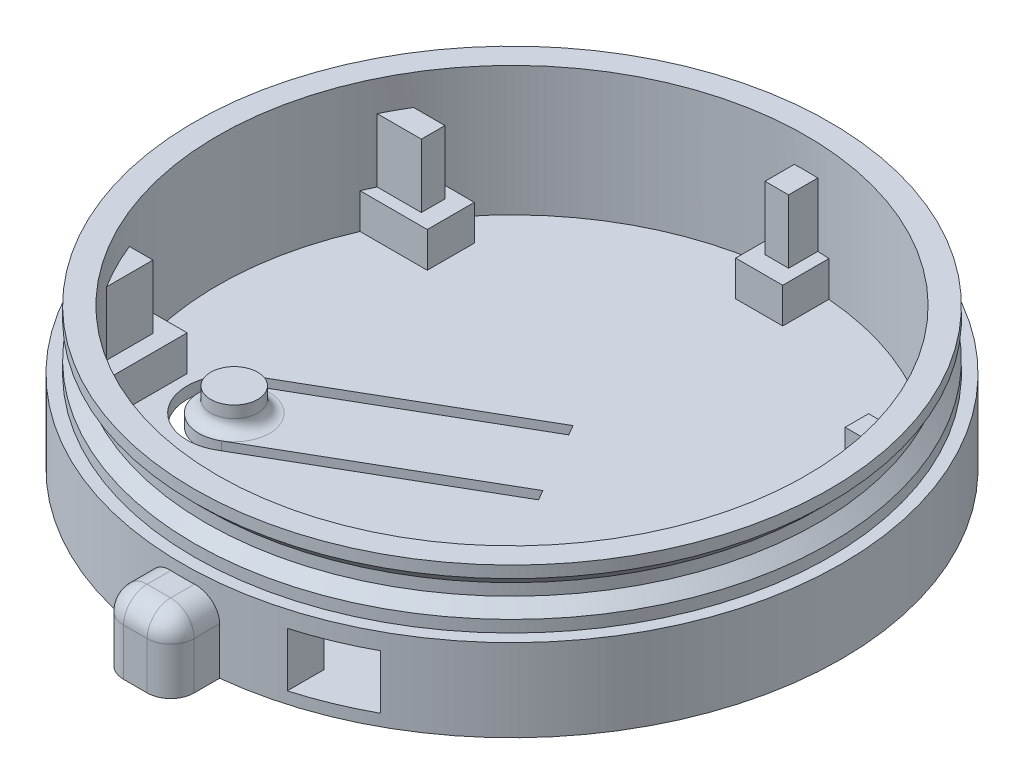
from build123d import *

# Parameters (mm, degrees)
SKETCH1_R              = 13.5
SKETCH1_R_2            = 12.5
BOSS_EXTRUDE1_DEPTH    = 6
SKETCH1_2_R            = 12.5
BOSS_EXTRUDE3_DEPTH    = 0.5
SKETCH1_3_R            = 14
SKETCH1_3_R_2          = 13.5
SKETCH1_3_R_3          = 13
SKETCH1_3_R_4          = 12.5
EXTRUDE_THIN1_DEPTH    = 3.5
SKETCH12_W             = 2.5
SKETCH12_H             = 2.5
SKETCH12_R             = 0.5
BOSS_EXTRUDE10_DEPTH   = 1.5
BOSS_EXTRUDE12_DEPTH   = 2.7
CUT_EXTRUDE1_DEPTH     = 10
SKETCH14_R             = 1
BOSS_EXTRUDE11_DEPTH   = 1
FILLET7_R              = 0.5
CUT_EXTRUDE2_DEPTH     = 2.3
BOSS_EXTRUDE13_DEPTH   = 3
BOSS_EXTRUDE13_2_DEPTH = 3
FILLET8_R              = 1
FILLET9_R              = 1
CUT_EXTRUDE3_START     = 1
SKETCH18_R             = 13.5
SKETCH18_R_2           = 13
CUT_EXTRUDE3_DEPTH     = 0.5
CHAMFER1_SIZE          = 0.5
CHAMFER3_SIZE          = 0.5


with BuildPart() as part:
    # Sketch1 → Boss-Extrude1 (new body)
    with BuildSketch(Plane(origin=(0, 0, 0), x_dir=(1, 0, 0), z_dir=(0, 1, 0))):
        with Locations(Location((0, 0, 0), (0, 0, 270))):
            Circle(SKETCH1_R)
        with Locations(Location((0, 0, 0), (0, 0, 270))):
            Circle(SKETCH1_R_2, mode=Mode.SUBTRACT)
    extrude(amount=BOSS_EXTRUDE1_DEPTH)

    # Sketch1<2> → Boss-Extrude3 (add)
    with BuildSketch(Plane(origin=(0, 0, 0), x_dir=(1, 0, 0), z_dir=(0, 1, 0))):
        with Locations(Location((0, 0, 0), (0, 0, 270))):
            Circle(SKETCH1_2_R)
    extrude(amount=BOSS_EXTRUDE3_DEPTH)

    # Sketch1<3> → Extrude-Thin1 (add)
    # profile 1 of 2: a face of its own
    with BuildSketch(Plane(origin=(0, 0, 0), x_dir=(1, 0, 0), z_dir=(0, 1, 0))):
        Circle(SKETCH1_3_R)
        Circle(SKETCH1_3_R_2, mode=Mode.SUBTRACT)
    # profile 2 of 2: a face of its own
    with BuildSketch(Plane(origin=(0, 0, 0), x_dir=(1, 0, 0), z_dir=(0, 1, 0))):
        Circle(SKETCH1_3_R_3)
        Circle(SKETCH1_3_R_4, mode=Mode.SUBTRACT)
    extrude(amount=EXTRUDE_THIN1_DEPTH)

    # Sketch12 → Boss-Extrude10 (add)
    # profile 1 of 5: a face of its own
    with BuildSketch(Plane(origin=(0, 0.5, 0), x_dir=(1, 0, 0), z_dir=(0, 1, 0))):
        with BuildLine():
            Line((-8.6, 5), (-8.6, 7))
            Line((-8.6, 7), (-10.356157589, 7))
            ThreePointArc((-10.356157589, 7), (-10.952047529, 6.025168456), (-11.456439237, 5))
            Line((-11.456439237, 5), (-8.6, 5))
        make_face()
    # profile 2 of 5: a face of its own
    with BuildSketch(Plane(origin=(0, 0.5, 0), x_dir=(1, 0, 0), z_dir=(0, 1, 0))):
        with BuildLine():
            Line((-1, 10.5), (1, 10.5))
            Line((1, 10.5), (1, 12.459935794))
            ThreePointArc((1, 12.459935794), (0, 12.5), (-1, 12.459935794))
            Line((-1, 12.459935794), (-1, 10.5))
        make_face()
    # profile 3 of 5: a face of its own
    with BuildSketch(Plane(origin=(0, 0.5, 0), x_dir=(1, 0, 0), z_dir=(0, 1, 0))):
        with BuildLine():
            Line((11.273420067, 5.4), (9.5, 5.4))
            Line((9.5, 5.4), (9.5, 3.4))
            Line((9.5, 3.4), (12.028715642, 3.4))
            ThreePointArc((12.028715642, 3.4), (11.693903632, 4.416176837), (11.273420067, 5.4))
        make_face()
    # profile 4 of 5: a face of its own
    with BuildSketch(Plane(origin=(0, 0.5, 0), x_dir=(1, 0, 0), z_dir=(0, 1, 0))):
        with BuildLine():
            Line((-9.9, -3.9), (-11.876026271, -3.9))
            ThreePointArc((-11.876026271, -3.9), (-11.046713471, -5.849796706), (-9.9, -7.631513611))
            Line((-9.9, -7.631513611), (-9.9, -3.9))
        make_face()
    # profile 5 of 5: a face of its own
    with BuildSketch(Plane(origin=(0, 0.5, 0), x_dir=(1, 0, 0), z_dir=(0, 1, 0))):
        with Locations((9.5, -4.1)):
            Rectangle(SKETCH12_W, SKETCH12_H)
        with Locations(Location((9.5, -4.1, 0), (0, 0, 270))):
            Circle(SKETCH12_R, mode=Mode.SUBTRACT)
    extrude(amount=BOSS_EXTRUDE10_DEPTH)

    # Sketch15 → Boss-Extrude12 (add)
    with BuildSketch(Plane(origin=(0, 2, 0), x_dir=(1, 0, 0), z_dir=(0, 1, 0))):
        with BuildLine():
            Line((0.5, 11.25), (0.5, 12.489995997))
            ThreePointArc((0.5, 12.489995997), (0, 12.5), (-0.5, 12.489995997))
            Line((-0.5, 12.489995997), (-0.5, 11.25))
            Line((-0.5, 11.25), (0.5, 11.25))
        make_face()
        with BuildLine():
            Line((-9.35, 5.5), (-9.35, 6))
            Line((-9.35, 6), (-9.35, 6.5))
            Line((-9.35, 6.5), (-10.677078252, 6.5))
            ThreePointArc((-10.677078252, 6.5), (-10.96243372, 6.006250655), (-11.22497216, 5.5))
            Line((-11.22497216, 5.5), (-9.35, 5.5))
        make_face()
        with BuildLine():
            Line((-11.602909118, -4.65), (-10.602909118, -4.65))
            Line((-10.602909118, -4.65), (-10.602909118, -6.620295933))
            ThreePointArc((-10.602909118, -6.620295933), (-11.146528939, -5.657286682), (-11.602909118, -4.65))
        make_face()
        with BuildLine():
            Line((10.25, 3.9), (11.876026271, 3.9))
            ThreePointArc((11.876026271, 3.9), (11.698485768, 4.404024379), (11.499565209, 4.9))
            Line((11.499565209, 4.9), (10.25, 4.9))
            Line((10.25, 4.9), (10.25, 3.9))
        make_face()
    extrude(amount=BOSS_EXTRUDE12_DEPTH)

    # Sketch13 → Cut-Extrude1 (cut)
    with BuildSketch(Plane(origin=(0, 0.5, 0), x_dir=(1, 0, 0), z_dir=(0, 1, 0))):
        with BuildLine():
            Line((0.209608339, 2.382785463), (-8.450166114, -2.618045109))
            ThreePointArc((-8.450166114, -2.618045109), (-7.773231209, -2.376292426), (-7.054544105, -2.38948613))
            Line((-7.054544105, -2.38948613), (0.459649868, 1.94979674))
            Line((0.459649868, 1.94979674), (0.209608339, 2.382785463))
        make_face()
        with BuildLine():
            ThreePointArc((-7.054544105, -2.38948613), (-7.773231209, -2.376292426), (-8.450166114, -2.618045109))
            Line((-8.450166114, -2.618045109), (-8.200124586, -3.051033832))
            Line((-8.200124586, -3.051033832), (-7.054544105, -2.38948613))
        make_face()
        with BuildLine():
            ThreePointArc((-8.450166114, -2.618045109), (-9.181954891, -5.350166114), (-6.449833886, -6.081954891))
            Line((-6.449833886, -6.081954891), (-6.699875414, -5.648966168))
            ThreePointArc((-6.699875414, -5.648966168), (-8.748966168, -5.100124586), (-8.200124586, -3.051033832))
            Line((-8.200124586, -3.051033832), (-8.450166114, -2.618045109))
        make_face()
        with BuildLine():
            Line((-6.699875414, -5.648966168), (-6.449833886, -6.081954891))
            ThreePointArc((-6.449833886, -6.081954891), (-5.902091744, -5.616483332), (-5.554294933, -4.987418466))
            Line((-5.554294933, -4.987418466), (-6.699875414, -5.648966168))
        make_face()
        with BuildLine():
            ThreePointArc((-5.554294933, -4.987418466), (-5.902091744, -5.616483332), (-6.449833886, -6.081954891))
            Line((-6.449833886, -6.081954891), (2.209940568, -1.081124319))
            Line((2.209940568, -1.081124319), (1.95989904, -0.648135596))
            Line((1.95989904, -0.648135596), (-5.554294933, -4.987418466))
        make_face()
    extrude(amount=-CUT_EXTRUDE1_DEPTH, mode=Mode.SUBTRACT)

    # Sketch14 → Boss-Extrude11 (add)
    with BuildSketch(Plane(origin=(0, 0.5, 0), x_dir=(1, 0, 0), z_dir=(0, 1, 0))):
        with Locations(Location((-7.45, -4.35, 0), (0, 0, 270))):
            Circle(SKETCH14_R)
    extrude(amount=BOSS_EXTRUDE11_DEPTH)

    # Fillet7
    fillet7_edges = [part.edges().sort_by_distance(p)[0] for p in [
        (-7.45, 0.5, 3.35),
    ]]
    fillet(fillet7_edges, radius=FILLET7_R - 0.0001)  # a hair under: the kernel refuses the full size

    # Sketch16 → Cut-Extrude2 (cut)
    with BuildSketch(Plane(origin=(0, 0.5, 0), x_dir=(1, 0, 0), z_dir=(0, 1, 0))):
        with BuildLine():
            Line((3.9, -10.1), (3.9, -13.445817193))
            ThreePointArc((3.9, -13.445817193), (5.331269165, -12.945175514), (6.7, -12.292680749))
            Line((6.7, -12.292680749), (6.7, -9.45))
            Line((6.7, -9.45), (3.9, -10.1))
        make_face()
    extrude(amount=CUT_EXTRUDE2_DEPTH, mode=Mode.SUBTRACT)

    # Sketch18 → Cut-Extrude3 (cut)
    with BuildSketch(Plane(origin=(0, 3.5, 0), x_dir=(1, 0, 0), z_dir=(0, 1, 0)).offset(CUT_EXTRUDE3_START)):
        with Locations(Location((0, 0, 0), (0, 0, 270))):
            Circle(SKETCH18_R)
        with Locations(Location((0, 0, 0), (0, 0, 270))):
            Circle(SKETCH18_R_2, mode=Mode.SUBTRACT)
    extrude(amount=CUT_EXTRUDE3_DEPTH, mode=Mode.SUBTRACT)

    # Chamfer1
    chamfer1_edges = [part.edges().sort_by_distance(p)[0] for p in [
        (0, 5, -13.5),
    ]]
    chamfer(chamfer1_edges, length=CHAMFER1_SIZE - 0.0001)  # a hair under: the kernel refuses the full size

    # Chamfer3
    chamfer3_edges = [part.edges().sort_by_distance(p)[0] for p in [
        (0, 4.5, -13.5),
    ]]
    chamfer(chamfer3_edges, length=CHAMFER3_SIZE - 0.0001)  # a hair under: the kernel refuses the full size


with BuildPart() as body_2:
    # Sketch17 → Boss-Extrude13 (new body)
    with BuildSketch(Plane(origin=(0, 0, 0), x_dir=(-1, 0, 0), z_dir=(0, -1, 0))):
        with BuildLine():
            Line((1.5, -15), (1.5, -13.919410907))
            ThreePointArc((1.5, -13.919410907), (0, -14), (-1.5, -13.919410907))
            Line((-1.5, -13.919410907), (-1.5, -15))
            ThreePointArc((-1.5, -15), (-1.207106781, -15.707106781), (-0.5, -16))
            Line((-0.5, -16), (0.5, -16))
            ThreePointArc((0.5, -16), (1.207106781, -15.707106781), (1.5, -15))
        make_face()
    extrude(amount=-BOSS_EXTRUDE13_DEPTH)

    # Fillet9
    fillet9_edges = [body_2.edges().sort_by_distance(p)[0] for p in [
        (1.5, 3, 14.459705454),
        (1.207106781, 3, 15.707106781),
        (0, 3, 16),
        (-1.207106781, 3, 15.707106781),
        (-1.5, 3, 14.459705454),
    ]]
    fillet(fillet9_edges, radius=FILLET9_R)


with BuildPart() as body_3:
    # Sketch17 → Boss-Extrude13 2 (new body)
    with BuildSketch(Plane(origin=(0, 0, 0), x_dir=(-1, 0, 0), z_dir=(0, -1, 0))):
        with BuildLine():
            ThreePointArc((1.5, 15), (1.207106781, 15.707106781), (0.5, 16))
            Line((0.5, 16), (-0.5, 16))
            ThreePointArc((-0.5, 16), (-1.207106781, 15.707106781), (-1.5, 15))
            Line((-1.5, 15), (-1.5, 13.919410907))
            ThreePointArc((-1.5, 13.919410907), (0, 14), (1.5, 13.919410907))
            Line((1.5, 13.919410907), (1.5, 15))
        make_face()
    extrude(amount=-BOSS_EXTRUDE13_2_DEPTH)

    # Fillet8
    fillet8_edges = [body_3.edges().sort_by_distance(p)[0] for p in [
        (1.207106781, 3, -15.707106781),
        (1.5, 3, -14.459705454),
        (-1.5, 3, -14.459705454),
        (-1.207106781, 3, -15.707106781),
        (0, 3, -16),
    ]]
    fillet(fillet8_edges, radius=FILLET8_R)


solid = Compound([part.part, body_2.part, body_3.part])
